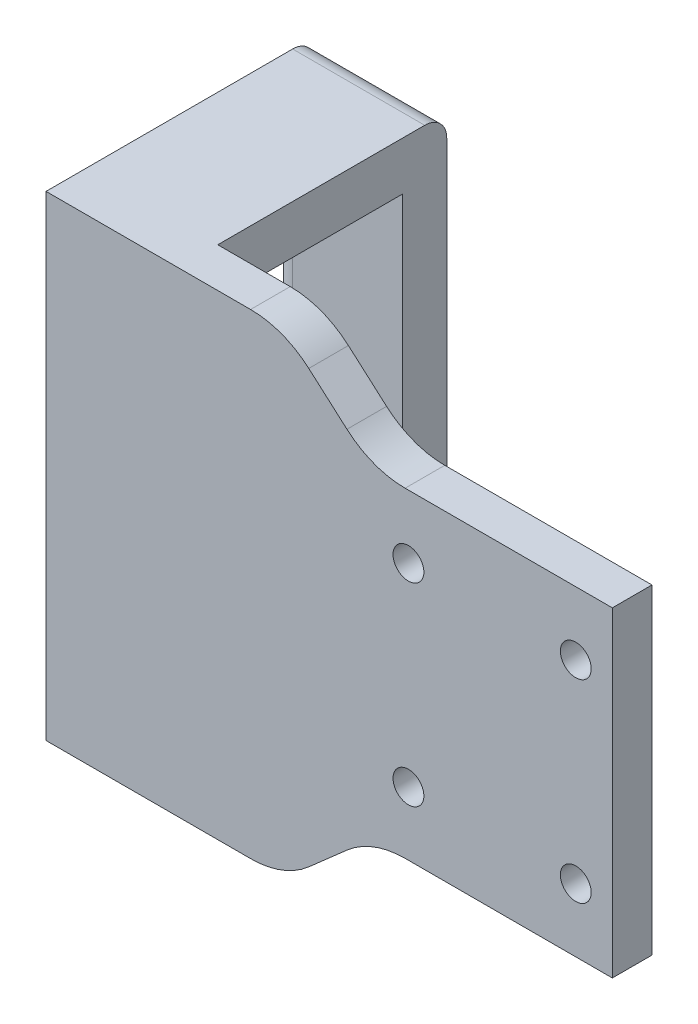
from build123d import *

# Parameters (mm, degrees)
SKETCH1_R           = 1.75
BOSS_EXTRUDE1_DEPTH = 4.5
SKETCH2_W           = 15
SKETCH2_H           = 54
BOSS_EXTRUDE2_DEPTH = 26
SKETCH5_W           = 21
SKETCH5_H           = 43
CUT_EXTRUDE1_DEPTH  = 15
SKETCH6_R           = 1.35
CUT_EXTRUDE2_DEPTH  = 12
CUT_EXTRUDE3_DEPTH  = 15
FILLET1_R           = 10
FILLET3_R           = 2.5


with BuildPart() as part:
    # Sketch1 → Boss-Extrude1 (new body)
    with BuildSketch(Plane.XY):
        Polygon((-13.65, -18.2), (13.65, -18.2), (13.65, 18.2), (-13.65, 18.2), (-23.65, 27), (-50.65, 27), (-50.65, -27), (-23.65, -27), align=None)
        with Locations((-9.5, 11)):
            Circle(SKETCH1_R, mode=Mode.SUBTRACT)
        with Locations(Location((9.5, 11, 0), (0, 0, 180))):
            Circle(SKETCH1_R, mode=Mode.SUBTRACT)
        with Locations(Location((-9.5, -11, 0), (0, 0, 180))):
            Circle(SKETCH1_R, mode=Mode.SUBTRACT)
        with Locations((9.5, -11)):
            Circle(SKETCH1_R, mode=Mode.SUBTRACT)
    extrude(amount=BOSS_EXTRUDE1_DEPTH)

    # Sketch2 → Boss-Extrude2 (add)
    with BuildSketch(Plane(origin=(0, 0, 0), x_dir=(-1, 0, 0), z_dir=(0, 0, -1))):
        with Locations((43.15, 0)):
            Rectangle(SKETCH2_W, SKETCH2_H)
    extrude(amount=BOSS_EXTRUDE2_DEPTH)

    # Sketch5 → Cut-Extrude1 (cut)
    with BuildSketch(Plane(origin=(-35.65, 0, 0), x_dir=(0, 0, -1), z_dir=(1, 0, 0))):
        with Locations((10.5, 0)):
            Rectangle(SKETCH5_W, SKETCH5_H)
    extrude(amount=-CUT_EXTRUDE1_DEPTH, mode=Mode.SUBTRACT)

    # Sketch6 → Cut-Extrude2 (cut)
    with BuildSketch(Plane.ZY.offset(50.65)):
        with Locations((-15.5, 24.75)):
            Circle(SKETCH6_R)
        with Locations(Location((-5.5, 24.75, 0), (0, 0, 180))):
            Circle(SKETCH6_R)
        with Locations((-5.5, -24.75)):
            Circle(SKETCH6_R)
        with Locations(Location((-15.5, -24.75, 0), (0, 0, 180))):
            Circle(SKETCH6_R)
    extrude(amount=-CUT_EXTRUDE2_DEPTH, mode=Mode.SUBTRACT)

    # Sketch8 → Cut-Extrude3 (cut)
    with BuildSketch(Plane.ZY.offset(50.65)):
        with BuildLine():
            Line((-15.5, -21.5), (-5.5, -21.5))
            ThreePointArc((-5.5, -21.5), (-10.5, -23.75), (-15.5, -21.5))
        make_face()
    extrude(amount=-CUT_EXTRUDE3_DEPTH, mode=Mode.SUBTRACT)

    # Fillet1
    fillet1_edges = [part.edges().sort_by_distance(p)[0] for p in [
        (-13.65, -18.2, 2.25),
        (-23.65, -27, 2.25),
        (-23.65, 27, 2.25),
        (-13.65, 18.2, 2.25),
    ]]
    fillet(fillet1_edges, radius=FILLET1_R)

    # Fillet3
    fillet3_edges = [part.edges().sort_by_distance(p)[0] for p in [
        (-43.15, 27, -26),
        (-43.15, -27, -26),
        (-50.65, 0, 0),
        (-50.65, 0, -21),
    ]]
    fillet(fillet3_edges, radius=FILLET3_R - 0.0001)  # a hair under: the kernel refuses the full size


solid = part.part
